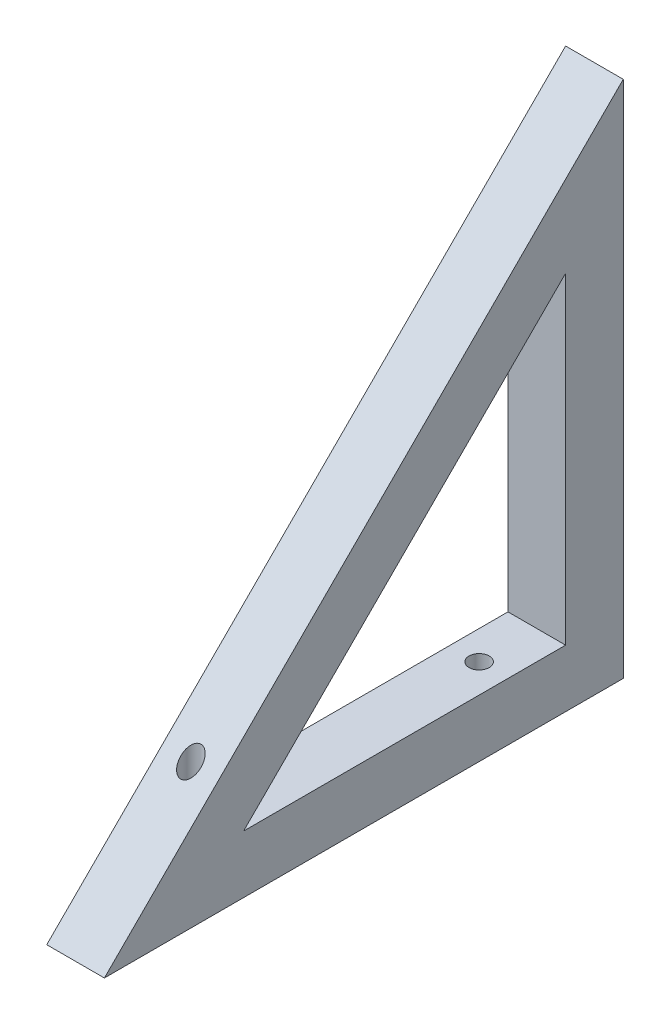
from build123d import *

# Parameters (mm, degrees)
BOSS_EXTRUDE1_DEPTH = 10
CUT_EXTRUDE1_REACH  = 129.671
SKETCH2_R           = 1.75


with BuildPart() as part:
    # Sketch1 → Boss-Extrude1 (new body)
    with BuildSketch(Plane(origin=(0, 0, 0), x_dir=(0, 0, -1), z_dir=(1, 0, 0))):
        Polygon((0, 0), (90, 0), (90, 90), align=None)
        Polygon((80, 65.857864376), (80, 10), (24.142135624, 10), align=None, mode=Mode.SUBTRACT)
    extrude(amount=BOSS_EXTRUDE1_DEPTH)

    # Sketch2 → Cut-Extrude1 (cut, up to next)
    with BuildSketch(Plane.XZ, mode=Mode.PRIVATE) as cut_extrude1_sk1:
        with Locations((5, -20)):
            Circle(SKETCH2_R)
    cut_extrude1_tool1 = extrude(cut_extrude1_sk1.sketch, amount=-CUT_EXTRUDE1_REACH, mode=Mode.PRIVATE) & part.part
    # Sketch2 → Cut-Extrude1 (cut, up to next)
    with BuildSketch(Plane.XZ, mode=Mode.PRIVATE) as cut_extrude1_sk2:
        with Locations((5, -70)):
            Circle(SKETCH2_R)
    cut_extrude1_tool2 = extrude(cut_extrude1_sk2.sketch, amount=-CUT_EXTRUDE1_REACH, mode=Mode.PRIVATE) & part.part
    add(cut_extrude1_tool1.solids().sort_by_distance((5, 0, -20))[0], mode=Mode.SUBTRACT)
    add(cut_extrude1_tool2.solids().sort_by_distance((5, 0, -70))[0], mode=Mode.SUBTRACT)


solid = part.part
